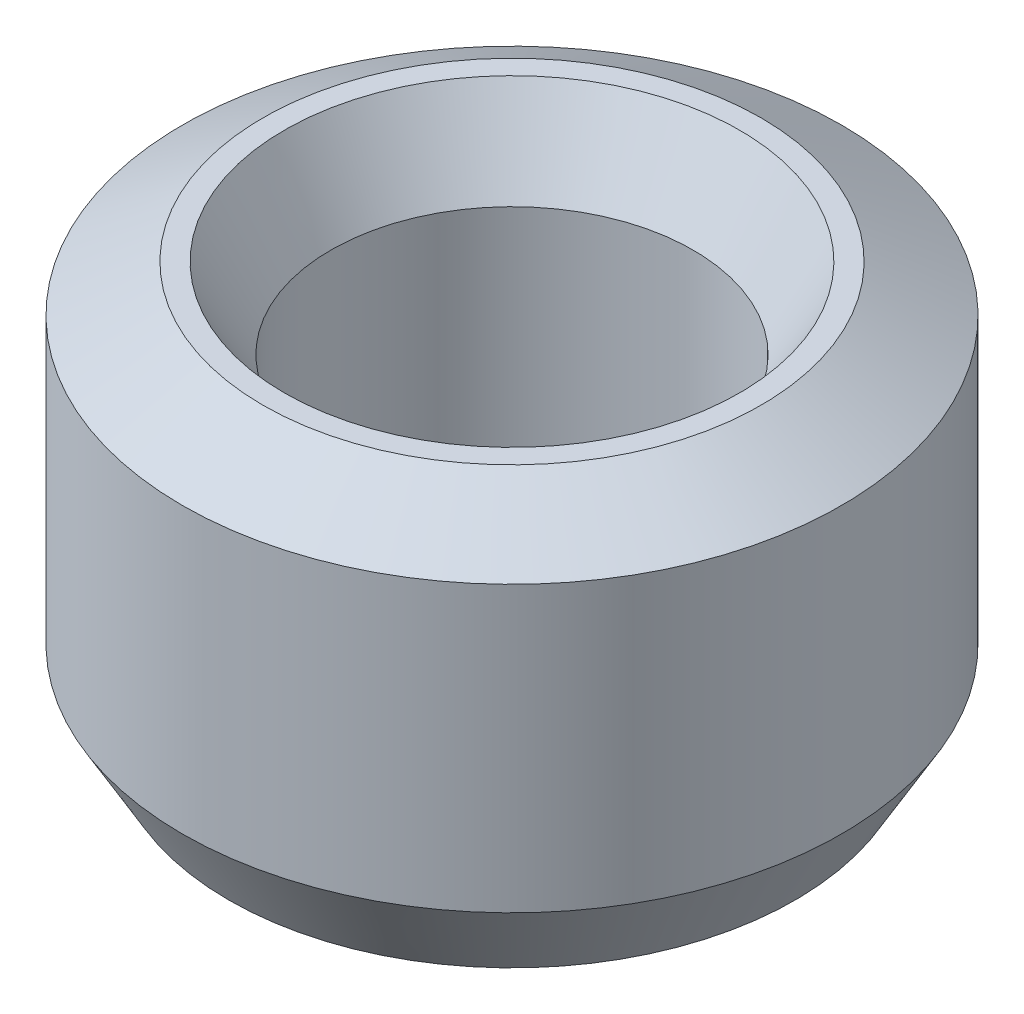
from build123d import *
from OCP.BRepFilletAPI import BRepFilletAPI_MakeChamfer

# Parameters (mm, degrees)
SKETCH1_R           = 5
BOSS_EXTRUDE1_DEPTH = 6.244525996
SKETCH2_R           = 2.747859949
CUT_EXTRUDE1_DEPTH  = 10.433668688
CHAMFER1_SIZE       = 0.705694612
CHAMFER1_SIZE2      = 1.222298923


with BuildPart() as part:
    # Sketch1 → Boss-Extrude1 (new body)
    with BuildSketch(Plane(origin=(0, 0, 0), x_dir=(1, 0, 0), z_dir=(0, 1, 0))):
        Circle(SKETCH1_R)
    extrude(amount=BOSS_EXTRUDE1_DEPTH)

    # Sketch2 → Cut-Extrude1 (cut, through all)
    with BuildSketch(Plane(origin=(0, 0, 0), x_dir=(1, 0, 0), z_dir=(0, 1, 0))):
        Circle(SKETCH2_R)
    extrude(amount=CUT_EXTRUDE1_DEPTH, mode=Mode.SUBTRACT)

    # Chamfer1: one chamfer whose edges measure the first distance from different faces: ONE call of the kernel's chamfer builder (chamfer() names one face for all edges)
    chamfer1_edges_1 = [part.edges().sort_by_distance(p)[0] for p in [
        (-2.747859949, 6.244525996, 0),
    ]]
    chamfer1_side_1 = [part.faces().sort_by_distance(p)[0] for p in [
        (-4.858578644, 6.244525996, 0),
    ]]
    chamfer1_edges_2 = [part.edges().sort_by_distance(p)[0] for p in [
        (-2.747859949, 0, 0),
    ]]
    chamfer1_side_2 = [part.faces().sort_by_distance(p)[0] for p in [
        (-2.747859949, 3.122262998, 0),
    ]]
    chamfer1_edges_3 = [part.edges().sort_by_distance(p)[0] for p in [
        (-5, 0, 0),
    ]]
    chamfer1_side_3 = [part.faces().sort_by_distance(p)[0] for p in [
        (-4.858578644, 0, 0),
    ]]
    chamfer1_edges_4 = [part.edges().sort_by_distance(p)[0] for p in [
        (-5, 6.244525996, 0),
    ]]
    chamfer1_side_4 = [part.faces().sort_by_distance(p)[0] for p in [
        (-5, 3.122262998, 0),
    ]]
    chamfer1 = BRepFilletAPI_MakeChamfer(part.part.solid().wrapped)
    for e in chamfer1_edges_1:
        chamfer1.Add(CHAMFER1_SIZE, CHAMFER1_SIZE2, e.wrapped, chamfer1_side_1[0].wrapped)  # the first distance lies on this face
    for e in chamfer1_edges_2:
        chamfer1.Add(CHAMFER1_SIZE, CHAMFER1_SIZE2, e.wrapped, chamfer1_side_2[0].wrapped)  # the first distance lies on this face
    for e in chamfer1_edges_3:
        chamfer1.Add(CHAMFER1_SIZE, CHAMFER1_SIZE2, e.wrapped, chamfer1_side_3[0].wrapped)  # the first distance lies on this face
    for e in chamfer1_edges_4:
        chamfer1.Add(CHAMFER1_SIZE, CHAMFER1_SIZE2, e.wrapped, chamfer1_side_4[0].wrapped)  # the first distance lies on this face
    add(Compound.cast(chamfer1.Shape()), mode=Mode.REPLACE)


solid = part.part
